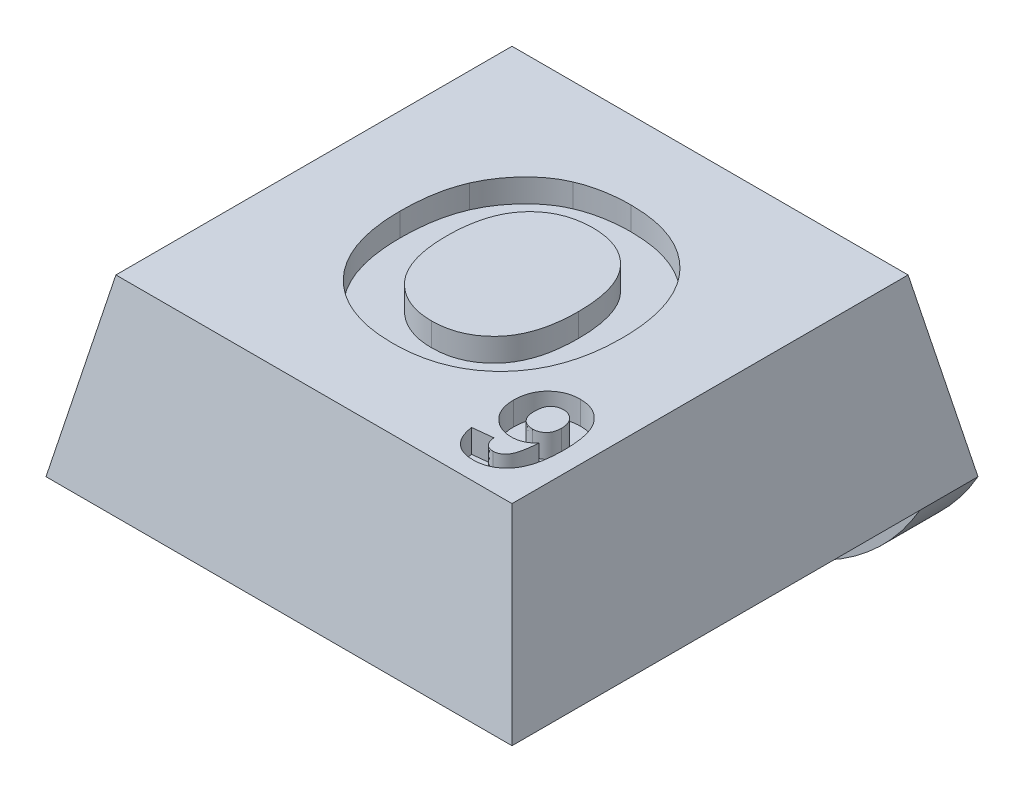
from build123d import *

# Parameters (mm, degrees)
SKETCH1_W               = 8
SKETCH1_H               = 8
BOSS_EXTRUDE1_DEPTH     = 3
CUT_EXTRUDE1_DEPTH      = 12.704699911
CUT_EXTRUDE1_DEPTH_BACK = 12.704699911
CUT_EXTRUDE2_DEPTH      = 11
SKETCH4_R               = 1.8
CUT_EXTRUDE3_DEPTH      = 0.8
SKETCH5_W               = 8
SKETCH5_H               = 1
BOSS_EXTRUDE2_DEPTH     = 2
FILLET1_R               = 4
CUT_EXTRUDE4_DEPTH      = 0.4
CUT_EXTRUDE5_DEPTH      = 0.4


with BuildPart() as part:
    # Sketch1 → Boss-Extrude1 (new body)
    with BuildSketch(Plane(origin=(0, 0, 0), x_dir=(1, 0, 0), z_dir=(0, 1, 0))):
        with Locations((4, 4)):
            Rectangle(SKETCH1_W, SKETCH1_H)
    extrude(amount=BOSS_EXTRUDE1_DEPTH)

    # Sketch2 → Cut-Extrude1 (cut, two sides: drawn at the far end of the back side and taken through both)
    with BuildSketch(Plane.XY.offset(-CUT_EXTRUDE1_DEPTH_BACK)):
        Polygon((0, 0), (0.6, 3), (0, 3), align=None)
        Polygon((8, 0), (7.4, 3), (8, 3), align=None)
    extrude(amount=CUT_EXTRUDE1_DEPTH + CUT_EXTRUDE1_DEPTH_BACK, mode=Mode.SUBTRACT)

    # Sketch3 → Cut-Extrude2 (cut)
    with BuildSketch(Plane(origin=(0, 0, 0), x_dir=(0, 0, -1), z_dir=(1, 0, 0))):
        Polygon((0, 0), (0.6, 3), (0, 3), align=None)
        Polygon((8, 3), (7.4, 3), (8, 0), align=None)
    extrude(amount=CUT_EXTRUDE2_DEPTH, mode=Mode.SUBTRACT)

    # Sketch4 → Cut-Extrude3 (cut)
    with BuildSketch(Plane.XZ):
        with Locations(Location((4, -3.75, 0), (0, 0, 270))):
            Circle(SKETCH4_R)
    extrude(amount=-CUT_EXTRUDE3_DEPTH, mode=Mode.SUBTRACT)

    # Sketch5 → Boss-Extrude2 (add)
    with BuildSketch(Plane.XZ):
        with Locations((4, -7.5)):
            Rectangle(SKETCH5_W, SKETCH5_H)
    extrude(amount=BOSS_EXTRUDE2_DEPTH)

    # Fillet1
    # the kernel refuses this fillet: 4 mm, written as the material it takes off along each edge
    with BuildSketch(Plane(origin=(8, -2, -16.660254038), x_dir=(0, 1, 0), z_dir=(0, 0, 1)), Plane(origin=(0, -2, 1.660254038), x_dir=(0, 1, 0), z_dir=(0, 0, -1))) as fillet1_piece_1:
        with BuildLine():
            CenterArc((4, 3.464101615), FILLET1_R, 180, 60)
            Line((0, 3.464101615), (-0.08, 3.464101615))
            Line((-0.08, 3.464101615), (-0.08, 0))
            Line((-0.08, 0), (0, -0.08))
            ThreePointArc((0, -0.08), (1, -0.08), (1.96, -0.069282032))
            Line((1.96, -0.069282032), (2, 0))
        make_face()
    extrude(amount=18.320508076, mode=Mode.SUBTRACT)

    # Sketch6 → Cut-Extrude4 (cut)
    with BuildSketch(Plane(origin=(0, 3, 0), x_dir=(1, 0, 0), z_dir=(0, 1, 0))):
        with BuildLine():
            add(Edge.make_bspline(
                [(2.089654898, 3.986528763), (2.089937962, 4.035959112), (2.090493863, 4.133033938), (2.100126328, 4.27544635), (2.112822668, 4.411953966), (2.133498637, 4.542019848), (2.157821125, 4.666252751), (2.188242102, 4.784615798), (2.224888607, 4.896693893), (2.254041192, 4.968254545), (2.268340796, 5.003355686)],
                knots=[0, 0, 0, 0, 1.141009212, 2.240794809, 3.294380675, 4.305229195, 5.280013876, 6.216333343, 7.125095522, 8, 8, 8, 8], degree=3))
            add(Edge.make_bspline(
                [(2.268340796, 5.003355686), (2.291715222, 5.053256024), (2.338189152, 5.15246979), (2.424498545, 5.292666818), (2.522325153, 5.424883974), (2.630863596, 5.548428123), (2.747342854, 5.661439376), (2.872312421, 5.758160736), (3.001332505, 5.841858689), (3.093095075, 5.883953785), (3.138533104, 5.904797994)],
                knots=[0, 0, 0, 0, 1.031372299, 2.050613973, 3.077158538, 4.108712802, 5.127684358, 6.111366908, 7.06480644, 8, 8, 8, 8], degree=3))
            add(Edge.make_bspline(
                [(3.138533104, 5.904797994), (3.169376267, 5.917449171), (3.231718165, 5.943020427), (3.328604813, 5.974934694), (3.429167615, 6.000863593), (3.532679205, 6.024041008), (3.640144595, 6.040022598), (3.750695421, 6.053422612), (3.864936689, 6.060445793), (3.94221093, 6.06137636), (3.981481822, 6.061849276)],
                knots=[0, 0, 0, 0, 0.92659354, 1.872881803, 2.832850937, 3.813025581, 4.820167273, 5.851730198, 6.908245912, 8, 8, 8, 8], degree=3))
            add(Edge.make_bspline(
                [(3.981481822, 6.061849276), (4.051799393, 6.060086645), (4.189411847, 6.056637153), (4.390424999, 6.03172188), (4.580644474, 5.989650147), (4.759426374, 5.9288409), (4.928312103, 5.852828021), (5.085989518, 5.7585427), (5.232691986, 5.647005393), (5.368136158, 5.519745635), (5.490113336, 5.376985207), (5.596345325, 5.220057705), (5.685459602, 5.049698506), (5.758850354, 4.866377637), (5.815245616, 4.669496317), (5.855991141, 4.459610063), (5.880197281, 4.23656428), (5.883057671, 4.083544992), (5.884526693, 4.00495825)],
                knots=[0, 0, 0, 0, 1.064641025, 2.083517118, 3.061799897, 4.009540929, 4.938075217, 5.861300345, 6.78508344, 7.723570974, 8.670267188, 9.622657076, 10.586935816, 11.576069104, 12.607749008, 13.683335114, 14.81022093, 16, 16, 16, 16], degree=3))
            add(Edge.make_bspline(
                [(5.884526693, 4.00495825), (5.883091601, 3.926897736), (5.880297745, 3.774928499), (5.855639782, 3.553632965), (5.816583507, 3.345276789), (5.758823703, 3.150335932), (5.687623357, 2.967322864), (5.597592073, 2.798417418), (5.493584902, 2.641379175), (5.37178097, 2.500157102), (5.2386164, 2.372167), (5.092100017, 2.261933284), (4.935570416, 2.167520211), (4.767605484, 2.091287667), (4.589299985, 2.031730764), (4.400072033, 1.989335741), (4.199824576, 1.964516346), (4.062748303, 1.961054329), (3.99269977, 1.959285173)],
                knots=[0, 0, 0, 0, 1.18845052, 2.313691126, 3.386664782, 4.412527756, 5.405809582, 6.372003093, 7.321919452, 8.268293321, 9.206237639, 10.129603466, 11.054616372, 11.9847576, 12.932764752, 13.912672021, 14.933336461, 16, 16, 16, 16], degree=3))
            add(Edge.make_bspline(
                [(3.99269977, 1.959285173), (3.921851099, 1.961058411), (3.783179897, 1.964529147), (3.580796614, 1.989272994), (3.389690252, 2.031681973), (3.209996896, 2.091448367), (3.040491004, 2.166522847), (2.882737558, 2.259971154), (2.736649357, 2.370903), (2.60237212, 2.497386547), (2.480643503, 2.638193424), (2.376784009, 2.794221956), (2.286748029, 2.961477617), (2.215173347, 3.142493932), (2.157731606, 3.335408473), (2.118579893, 3.541331287), (2.09387425, 3.75969562), (2.091087056, 3.909535694), (2.089654898, 3.986528763)],
                knots=[0, 0, 0, 0, 1.080878253, 2.11558926, 3.1052859, 4.062802436, 5.000434901, 5.928596448, 6.853693179, 7.793554778, 8.738606028, 9.68692032, 10.647726704, 11.63151566, 12.651483354, 13.714466703, 14.825613081, 16, 16, 16, 16], degree=3))
        make_face()
        with BuildLine():
            add(Edge.make_bspline(
                [(2.858885668, 4.012971071), (2.85965412, 3.957640503), (2.861142212, 3.850493912), (2.876992368, 3.694973228), (2.901046254, 3.549583199), (2.936421027, 3.414488839), (2.98111032, 3.289592419), (3.035863968, 3.174789463), (3.100455695, 3.069908984), (3.176556171, 2.977165157), (3.258890919, 2.894362796), (3.347763935, 2.822717871), (3.441518937, 2.761052648), (3.541778172, 2.712368162), (3.646455066, 2.673731696), (3.756362885, 2.645084172), (3.872048117, 2.629353868), (3.950988508, 2.627098013), (3.991097206, 2.62595184)],
                knots=[0, 0, 0, 0, 1.313550922, 2.543666373, 3.708465049, 4.810029406, 5.85539231, 6.85404609, 7.825601258, 8.772642133, 9.696587791, 10.59409323, 11.479048685, 12.35559886, 13.234601248, 14.125357077, 15.047515647, 16, 16, 16, 16], degree=3))
            add(Edge.make_bspline(
                [(3.991097206, 2.62595184), (4.031211308, 2.62707479), (4.110162334, 2.629284937), (4.225705423, 2.645336869), (4.335831051, 2.6727565), (4.440092094, 2.711194976), (4.538963761, 2.760652512), (4.632359934, 2.820935331), (4.719742254, 2.892906209), (4.801987382, 2.974505658), (4.876033724, 3.06786548), (4.940075505, 3.17272786), (4.994802176, 3.288227099), (5.039496175, 3.414406406), (5.074000367, 3.551503186), (5.097072556, 3.699589977), (5.113050883, 3.858243352), (5.114532906, 3.967789388), (5.115295924, 4.02418902)],
                knots=[0, 0, 0, 0, 0.949153107, 1.868086493, 2.754172764, 3.630100905, 4.492260106, 5.365378617, 6.254840125, 7.166615376, 8.102436631, 9.067266169, 10.06813181, 11.121736829, 12.23011542, 13.408501285, 14.665770308, 16, 16, 16, 16], degree=3))
            add(Edge.make_bspline(
                [(5.115295924, 4.02418902), (5.114434086, 4.080044083), (5.112765054, 4.18821272), (5.098229512, 4.344863246), (5.07442298, 4.490602534), (5.041329269, 4.625392829), (4.997593851, 4.74925585), (4.945357013, 4.862530314), (4.882195257, 4.964624424), (4.809756461, 5.055485317), (4.729599598, 5.135460421), (4.643086506, 5.205475199), (4.549725647, 5.26373175), (4.45042821, 5.312746734), (4.344160403, 5.349110772), (4.232002157, 5.375634395), (4.113636071, 5.391967682), (4.032549387, 5.394095071), (3.991097206, 5.395182609)],
                knots=[0, 0, 0, 0, 1.332337092, 2.580197383, 3.749299508, 4.852775005, 5.886662144, 6.878700295, 7.822989687, 8.743523536, 9.644687758, 10.519443927, 11.392806431, 12.264866173, 13.155606721, 14.065961015, 15.011303331, 16, 16, 16, 16], degree=3))
            add(Edge.make_bspline(
                [(3.991097206, 5.395182609), (3.949639786, 5.394111799), (3.868542852, 5.392017134), (3.749992261, 5.375413426), (3.637480681, 5.349680139), (3.531227894, 5.311239711), (3.431065544, 5.262695426), (3.337364104, 5.202490837), (3.249385236, 5.13259488), (3.168510191, 5.05140717), (3.094897659, 4.95975062), (3.031705485, 4.856409024), (2.977820274, 4.742511001), (2.933610582, 4.617719403), (2.900837529, 4.481690937), (2.87564871, 4.335339795), (2.861503604, 4.177780175), (2.859777069, 4.069088169), (2.858885668, 4.012971071)],
                knots=[0, 0, 0, 0, 0.981996942, 1.920933313, 2.83127778, 3.712125466, 4.592427284, 5.463259035, 6.34592384, 7.249932058, 8.173122297, 9.125107726, 10.113123258, 11.154048744, 12.256187849, 13.424658091, 14.670364834, 16, 16, 16, 16], degree=3))
        make_face(mode=Mode.SUBTRACT)
    extrude(amount=-CUT_EXTRUDE4_DEPTH, mode=Mode.SUBTRACT)

    # Sketch7 → Cut-Extrude5 (cut)
    with BuildSketch(Plane(origin=(0, 3, 0), x_dir=(1, 0, 0), z_dir=(0, 1, 0))):
        with BuildLine():
            Line((5.919673238, 1.385150086), (6.265827085, 1.42337124))
            add(Edge.make_bspline(
                [(6.265827085, 1.42337124), (6.268093719, 1.406798429), (6.272378124, 1.375472412), (6.286077938, 1.332486308), (6.303248644, 1.295587697), (6.326582557, 1.265894382), (6.354429027, 1.243230056), (6.386321993, 1.226875754), (6.42238873, 1.217455211), (6.447742367, 1.216285786), (6.4608992, 1.215678932)],
                knots=[0, 0, 0, 0, 1.261142327, 2.383817955, 3.394783384, 4.319218401, 5.209639591, 6.086630953, 7.00709008, 8, 8, 8, 8], degree=3))
            add(Edge.make_bspline(
                [(6.4608992, 1.215678932), (6.469463915, 1.215877443), (6.48639024, 1.216269757), (6.511151402, 1.221800705), (6.535112542, 1.229554718), (6.558026685, 1.240903559), (6.579674771, 1.255509372), (6.600593604, 1.273042464), (6.620141529, 1.294064918), (6.639558346, 1.318194878), (6.657133692, 1.347837476), (6.672644926, 1.383790834), (6.687127361, 1.426044982), (6.699023874, 1.475125411), (6.709731865, 1.530609127), (6.719047247, 1.592673694), (6.726604955, 1.661357033), (6.729945358, 1.709414119), (6.731692469, 1.734549125)],
                knots=[0, 0, 0, 0, 0.636702566, 1.258306339, 1.881198412, 2.509855161, 3.155497192, 3.822694, 4.538353708, 5.290656154, 6.125969777, 7.095962945, 8.203044623, 9.449504243, 10.854253673, 12.411741228, 14.12325476, 16, 16, 16, 16], degree=3))
            add(Edge.make_bspline(
                [(6.731692469, 1.734549125), (6.720618656, 1.722663456), (6.698785026, 1.699229134), (6.66262354, 1.668484234), (6.624120879, 1.642635813), (6.583474019, 1.621801075), (6.541107005, 1.604779019), (6.496323285, 1.593582217), (6.449746419, 1.585900099), (6.417902627, 1.585242808), (6.401764585, 1.584909702)],
                knots=[0, 0, 0, 0, 1.041520616, 2.053509057, 3.037255372, 4.009786987, 4.979165048, 5.959157055, 6.965725879, 8, 8, 8, 8], degree=3))
            add(Edge.make_bspline(
                [(6.401764585, 1.584909702), (6.384073531, 1.585417068), (6.349144023, 1.58641882), (6.297757672, 1.59369416), (6.248246766, 1.606100449), (6.20053226, 1.62330461), (6.154855365, 1.646107833), (6.110633648, 1.672992311), (6.068816059, 1.705534296), (6.02879244, 1.741895892), (5.992799641, 1.782831269), (5.960655082, 1.826725194), (5.933454298, 1.873819086), (5.911514497, 1.924062891), (5.894546495, 1.977136799), (5.882210111, 2.032996238), (5.875002086, 2.091932278), (5.874020377, 2.132245686), (5.873519392, 2.152818355)],
                knots=[0, 0, 0, 0, 0.980269742, 1.935460739, 2.869230488, 3.804804075, 4.740187949, 5.694100724, 6.667990488, 7.67211685, 8.68661751, 9.683203946, 10.682901945, 11.694007529, 12.71565541, 13.766145059, 14.860022949, 16, 16, 16, 16], degree=3))
            add(Edge.make_bspline(
                [(5.873519392, 2.152818355), (5.873975276, 2.174237886), (5.874869524, 2.216253842), (5.882714765, 2.277509257), (5.89469614, 2.335819022), (5.91258647, 2.390666415), (5.934848394, 2.442640499), (5.9625181, 2.491089482), (5.994678957, 2.536687239), (6.032260336, 2.578077882), (6.073111954, 2.615966992), (6.117181051, 2.64893897), (6.164211963, 2.676494183), (6.213788023, 2.699393552), (6.266281134, 2.717029421), (6.321355802, 2.729597085), (6.379065584, 2.737389696), (6.418446315, 2.73829424), (6.438543431, 2.738755855)],
                knots=[0, 0, 0, 0, 1.1238417, 2.204496613, 3.236450213, 4.243990082, 5.227299393, 6.199188572, 7.167261658, 8.150145869, 9.127934804, 10.088143708, 11.032722787, 11.984040773, 12.949643861, 13.93368149, 14.945498424, 16, 16, 16, 16], degree=3))
            add(Edge.make_bspline(
                [(6.438543431, 2.738755855), (6.460453106, 2.738150473), (6.503415401, 2.73696339), (6.566381423, 2.727078367), (6.626126126, 2.710260061), (6.683243159, 2.687706994), (6.736909249, 2.657660802), (6.787822577, 2.621397782), (6.835302892, 2.578177603), (6.880181486, 2.528856177), (6.92101348, 2.47186563), (6.955777905, 2.405999335), (6.985348869, 2.331880957), (7.009217525, 2.249351324), (7.027868081, 2.158431597), (7.040740471, 2.059123523), (7.049353916, 1.951407429), (7.050070695, 1.876754909), (7.050442469, 1.838034702)],
                knots=[0, 0, 0, 0, 0.854852685, 1.67626545, 2.479841517, 3.273455256, 4.067207639, 4.874322592, 5.708061326, 6.568303409, 7.473035808, 8.43640186, 9.467839227, 10.582672616, 11.785182758, 13.086903962, 14.489057258, 16, 16, 16, 16], degree=3))
            add(Edge.make_bspline(
                [(7.050442469, 1.838034702), (7.049905126, 1.79871546), (7.048866956, 1.722749047), (7.040490349, 1.613081373), (7.027231708, 1.511820305), (7.007737917, 1.419146767), (6.983274539, 1.334727535), (6.952513245, 1.258884181), (6.916686501, 1.191225552), (6.874746552, 1.132374631), (6.828639372, 1.081226557), (6.77908296, 1.036914907), (6.726006277, 0.999573302), (6.669869922, 0.96842552), (6.609834533, 0.945100242), (6.546730883, 0.928201542), (6.480389219, 0.917254763), (6.43498132, 0.916210596), (6.411860738, 0.915678932)],
                knots=[0, 0, 0, 0, 1.487495966, 2.873904204, 4.158892752, 5.348685137, 6.453750751, 7.479786756, 8.440129076, 9.343583348, 10.206541379, 11.040779453, 11.853317241, 12.65721927, 13.463689683, 14.283322899, 15.125910407, 16, 16, 16, 16], degree=3))
            add(Edge.make_bspline(
                [(6.411860738, 0.915678932), (6.395260473, 0.91602056), (6.362689978, 0.916690848), (6.315004498, 0.922083364), (6.269756957, 0.931453812), (6.22709796, 0.944540129), (6.186694571, 0.960632245), (6.148889811, 0.981047781), (6.113673831, 1.005320091), (6.080446982, 1.032703168), (6.050544064, 1.06444472), (6.023036939, 1.099489729), (5.998361231, 1.138188869), (5.977345666, 1.180874772), (5.957946225, 1.226557184), (5.942319159, 1.276248618), (5.929285874, 1.329388352), (5.922934037, 1.366234586), (5.919673238, 1.385150086)],
                knots=[0, 0, 0, 0, 1.056675019, 2.073245589, 3.050223185, 3.994251036, 4.910773036, 5.814621688, 6.723026041, 7.630269412, 8.550362125, 9.493303905, 10.463425011, 11.466105649, 12.519144845, 13.620215273, 14.778306119, 16, 16, 16, 16], degree=3))
        make_face()
        with BuildLine():
            add(Edge.make_bspline(
                [(6.704288623, 2.144164509), (6.704161126, 2.155596857), (6.703913334, 2.177815627), (6.699699382, 2.209992235), (6.693585254, 2.240123792), (6.685487612, 2.268544564), (6.674181885, 2.29478467), (6.660772094, 2.319257309), (6.644926849, 2.341766242), (6.620534086, 2.368061578), (6.587423021, 2.396365915), (6.543067414, 2.420951263), (6.495426581, 2.436280337), (6.46245481, 2.437923574), (6.445754969, 2.438755855)],
                knots=[0, 0, 0, 0, 0.937516427, 1.822063352, 2.657744432, 3.45986214, 4.242145632, 4.997087526, 5.746986504, 6.494090859, 7.936347984, 9.300605415, 10.632786197, 12, 12, 12, 12], degree=3))
            add(Edge.make_bspline(
                [(6.445754969, 2.438755855), (6.430166677, 2.438049049), (6.399825759, 2.436673327), (6.356401274, 2.424308935), (6.317063151, 2.404241152), (6.288409376, 2.380829385), (6.267989359, 2.358499377), (6.255191006, 2.338496725), (6.244293407, 2.316200896), (6.235271023, 2.291421796), (6.228151789, 2.264145996), (6.22310419, 2.234228027), (6.220356515, 2.201908816), (6.219905587, 2.179506028), (6.219673238, 2.167962586)],
                knots=[0, 0, 0, 0, 1.397188569, 2.719475933, 4.017809812, 5.337496372, 6.01771949, 6.727108146, 7.460709441, 8.242571956, 9.09066939, 9.98839818, 10.963485712, 12, 12, 12, 12], degree=3))
            add(Edge.make_bspline(
                [(6.219673238, 2.167962586), (6.21985919, 2.156174267), (6.220218572, 2.133391395), (6.223589754, 2.100385349), (6.228647094, 2.069760423), (6.236862223, 2.041755733), (6.246514376, 2.015972616), (6.258169977, 1.992332693), (6.272971404, 1.971709233), (6.294352761, 1.947247537), (6.325634684, 1.922347167), (6.368049363, 1.900635228), (6.414905277, 1.887212479), (6.447708858, 1.885689499), (6.464504969, 1.884909702)],
                knots=[0, 0, 0, 0, 1.000122719, 1.932902026, 2.813346472, 3.630219284, 4.405058741, 5.14865055, 5.858963796, 6.55275156, 7.902081098, 9.220520156, 10.576848858, 12, 12, 12, 12], degree=3))
            add(Edge.make_bspline(
                [(6.464504969, 1.884909702), (6.480827547, 1.885549269), (6.512677039, 1.886797228), (6.557990171, 1.900126415), (6.599587786, 1.920571896), (6.630021148, 1.944701937), (6.651777108, 1.967556777), (6.665779678, 1.987183928), (6.677850945, 2.008665471), (6.687490977, 2.032192213), (6.69507263, 2.05755983), (6.700411291, 2.084726876), (6.703726875, 2.113793779), (6.704097261, 2.133818605), (6.704288623, 2.144164509)],
                knots=[0, 0, 0, 0, 1.470045212, 2.868431389, 4.227473852, 5.634383908, 6.348475288, 7.071419378, 7.805118666, 8.569021284, 9.362200428, 10.192314795, 11.06605236, 12, 12, 12, 12], degree=3))
        make_face(mode=Mode.SUBTRACT)
    extrude(amount=-CUT_EXTRUDE5_DEPTH, mode=Mode.SUBTRACT)


solid = part.part
